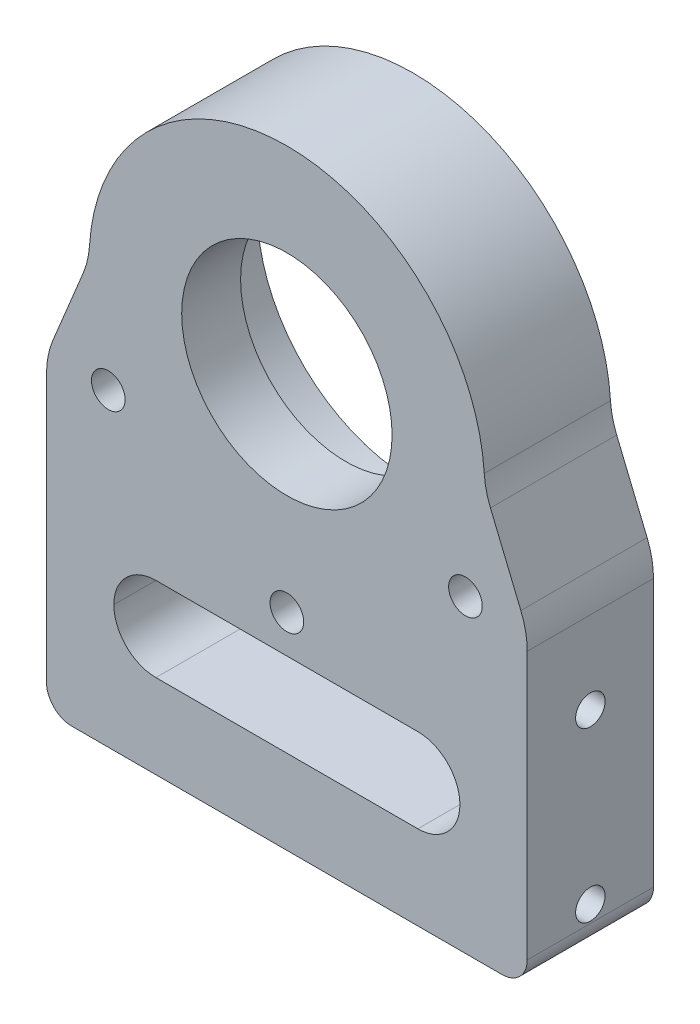
from build123d import *

# Parameters (mm, degrees)
SKETCH_1_W          = 57.12
SKETCH_1_H          = 30
EXTRUDE_1_DEPTH     = 15
SKETCH_2_R          = 1.75
CUT_EXTRUDE_1_DEPTH = 61.93188328
SKETCH_4_R          = 18.5
EXTRUDE_4_DEPTH     = 15
SKETCH_5_R          = 18.5
SKETCH_5_R_2        = 12.5
EXTRUDE_5_DEPTH     = 7
SKETCH_6_R          = 18.5
SKETCH_6_R_2        = 17.5
EXTRUDE_6_DEPTH     = 1
FILLET_1_R          = 3
SKETCH_7_R          = 2
CUT_EXTRUDE_2_DEPTH = 71.387692106
CUT_EXTRUDE_3_DEPTH = 71.387692168
FILLET_2_R          = 10
SKETCH_9_W          = 41.12
SKETCH_9_H          = 10
CUT_EXTRUDE_4_DEPTH = 66.931203604
FILLET_3_R          = 5


with BuildPart() as part:
    # ｽｹｯﾁ1 → ﾎﾞｽ - 押し出し1 (new body)
    with BuildSketch(Plane.XY):
        Rectangle(SKETCH_1_W, SKETCH_1_H)
    extrude(amount=EXTRUDE_1_DEPTH)

    # ｽｹｯﾁ2 → ｶｯﾄ - 押し出し1 (cut, through all)
    with BuildSketch(Plane.ZY.offset(28.56)):
        with Locations((7.5, 10)):
            Circle(SKETCH_2_R)
        with Locations(Location((7.5, -10, 0), (0, 0, 180))):
            Circle(SKETCH_2_R)
    extrude(amount=-CUT_EXTRUDE_1_DEPTH, mode=Mode.SUBTRACT)

    # ｽｹｯﾁ4 → ﾎﾞｽ - 押し出し4 (add, through all)
    with BuildSketch(Plane.XY.offset(15)):
        with BuildLine():
            Line((-28.56, 34), (-28.56, 15))
            Line((-28.56, 15), (28.56, 15))
            Line((28.56, 15), (28.56, 34))
            ThreePointArc((28.56, 34), (0, 62.56), (-28.56, 34))
        make_face()
        with Locations((0, 34)):
            Circle(SKETCH_4_R, mode=Mode.SUBTRACT)
    extrude(amount=-EXTRUDE_4_DEPTH)

    # ｽｹｯﾁ5 → ﾎﾞｽ - 押し出し5 (add)
    with BuildSketch(Plane.XY.offset(15)):
        with Locations((0, 34)):
            Circle(SKETCH_5_R)
        with Locations((0, 34)):
            Circle(SKETCH_5_R_2, mode=Mode.SUBTRACT)
    extrude(amount=-EXTRUDE_5_DEPTH)

    # ｽｹｯﾁ6 → ﾎﾞｽ - 押し出し6 (add)
    with BuildSketch(Plane(origin=(0, 0, 8), x_dir=(-1, 0, 0), z_dir=(0, 0, -1))):
        with Locations(Location((0, 34, 0), (0, 0, 180))):
            Circle(SKETCH_6_R)
        with Locations((0, 34)):
            Circle(SKETCH_6_R_2, mode=Mode.SUBTRACT)
    extrude(amount=EXTRUDE_6_DEPTH)

    # ﾌｨﾚｯﾄ1
    fillet_1_edges = [part.edges().sort_by_distance(p)[0] for p in [
        (28.56, -15, 7.5),
        (-28.56, -15, 7.5),
    ]]
    fillet(fillet_1_edges, radius=FILLET_1_R)

    # ｽｹｯﾁ7 → ｶｯﾄ - 押し出し2 (cut, through all)
    with BuildSketch(Plane(origin=(0, 0, 0), x_dir=(-1, 0, 0), z_dir=(0, 0, -1))):
        with Locations((0, 9.5)):
            Circle(SKETCH_7_R)
        with Locations((-21.217622393, 21.75)):
            Circle(SKETCH_7_R)
        with Locations(Location((21.217622393, 21.75, 0), (0, 0, 180))):
            Circle(SKETCH_7_R)
    extrude(amount=-CUT_EXTRUDE_2_DEPTH, mode=Mode.SUBTRACT)

    # ｽｹｯﾁ8 → ｶｯﾄ - 押し出し3 (cut, through all)
    with BuildSketch(Plane(origin=(0, 0, 0), x_dir=(-1, 0, 0), z_dir=(0, 0, -1))):
        with BuildLine():
            Line((-28.56, 34), (-28.56, 21.75))
            Line((-28.56, 21.75), (-23.5, 34))
            ThreePointArc((-23.5, 34), (0, 57.5), (23.5, 34))
            Line((23.5, 34), (28.56, 21.75))
            Line((28.56, 21.75), (28.56, 34))
            ThreePointArc((28.56, 34), (0, 62.56), (-28.56, 34))
        make_face()
    extrude(amount=-CUT_EXTRUDE_3_DEPTH, mode=Mode.SUBTRACT)

    # ﾌｨﾚｯﾄ2
    fillet_2_edges = [part.edges().sort_by_distance(p)[0] for p in [
        (23.5, 34, 7.5),
        (28.56, 21.75, 7.5),
        (-28.56, 21.75, 7.5),
        (-23.5, 34, 7.5),
    ]]
    fillet(fillet_2_edges, radius=FILLET_2_R)

    # ｽｹｯﾁ9 → ｶｯﾄ - 押し出し4 (cut, through all)
    with BuildSketch(Plane(origin=(0, 0, 0), x_dir=(-1, 0, 0), z_dir=(0, 0, -1))):
        Rectangle(SKETCH_9_W, SKETCH_9_H)
    extrude(amount=-CUT_EXTRUDE_4_DEPTH, mode=Mode.SUBTRACT)

    # ﾌｨﾚｯﾄ3
    fillet_3_edges = [part.edges().sort_by_distance(p)[0] for p in [
        (-20.56, 5, 7.5),
        (-20.56, -5, 7.5),
        (20.56, 5, 7.5),
        (20.56, -5, 7.5),
    ]]
    fillet(fillet_3_edges, radius=FILLET_3_R - 0.0001)  # a hair under: the kernel refuses the full size


solid = part.part
